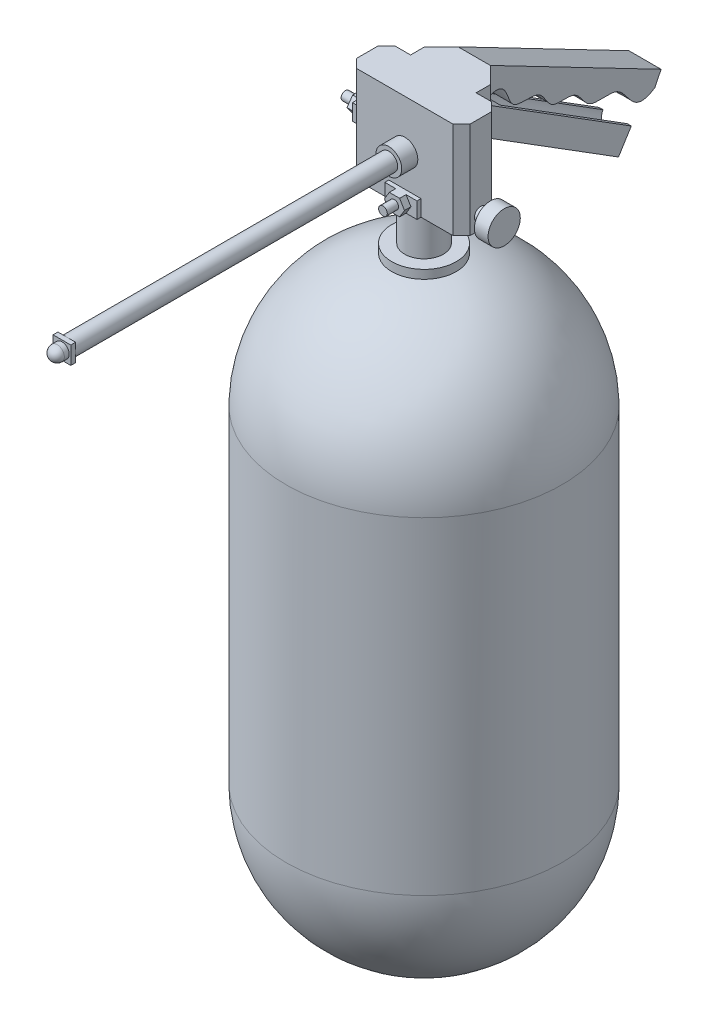
from build123d import *

# Parameters (mm, degrees)
SKETCH1_R                = 85.725
BOSS_EXTRUDE1_DEPTH      = 203.2
BOSS_EXTRUDE2_DEPTH      = 3
BOSS_EXTRUDE2_DEPTH_BACK = 3
SKETCH31_R               = 20
SKETCH32_R               = 12
BOSS_EXTRUDE3_DEPTH      = 25
BOSS_EXTRUDE6_DEPTH      = 60
SKETCH34_R               = 4
BOSS_EXTRUDE7_DEPTH      = 6
SKETCH35_R               = 10
BOSS_EXTRUDE8_DEPTH      = 8.5
SKETCH36_W               = 20
SKETCH36_H               = 10
BOSS_EXTRUDE9_DEPTH      = 2.5
BOSS_EXTRUDE10_DEPTH     = 4
SKETCH38_R               = 2.7
BOSS_EXTRUDE11_DEPTH     = 7
SKETCH39_W               = 13.421237438
SKETCH39_H               = 10
BOSS_EXTRUDE12_DEPTH     = 2.5
BOSS_EXTRUDE13_DEPTH     = 4
SKETCH41_R               = 2.7
BOSS_EXTRUDE14_DEPTH     = 7
SKETCH42_R               = 8
BOSS_EXTRUDE15_DEPTH     = 10
SKETCH43_R               = 5.5
BOSS_EXTRUDE16_DEPTH     = 200
SKETCH44_W               = 11
SKETCH44_H               = 11
BOSS_EXTRUDE17_DEPTH     = 3
SKETCH45_R               = 4.5
BOSS_EXTRUDE18_DEPTH     = 3
REVOLVE3_ANGLE           = 180
BOSS_EXTRUDE19_DEPTH     = 16
BOSS_EXTRUDE20_DEPTH     = 20
BOSS_EXTRUDE21_DEPTH     = 20
CUT_EXTRUDE2_DEPTH       = 93


with BuildPart() as part:
    # Sketch1 → Boss-Extrude1 (new body)
    with BuildSketch(Plane(origin=(0, 0, 0), x_dir=(1, 0, 0), z_dir=(0, 1, 0))):
        Circle(SKETCH1_R)
    extrude(amount=BOSS_EXTRUDE1_DEPTH)

    # Sketch28 → Revolve1 (revolve)
    with BuildSketch(Plane.XY):
        with BuildLine():
            Line((0, 287.318360821), (0, 201.578017622))
            Line((0, 201.578017622), (-85.725, 203.2))
            ThreePointArc((-85.725, 203.2), (-60.051382691, 262.776366365), (0, 287.318360821))
        make_face()
    revolve(axis=Axis((0, 313.857447871, 0), (0, -1, 0)))

    # Sketch29 → Revolve2 (revolve)
    with BuildSketch(Plane.XY):
        with BuildLine():
            Line((0, 0), (0, -85.725))
            ThreePointArc((0, -85.725), (60.616728817, -60.616728817), (85.725, 0))
            Line((85.725, 0), (0, 0))
        make_face()
    revolve(axis=Axis((0, 313.857447871, 0), (0, -1, 0)))

    # Sketch31 → Boss-Extrude2 (add, two sides: drawn at the far end of the back side and taken through both)
    with BuildSketch(Plane(origin=(0, 287.318360821, 0), x_dir=(1, 0, 0), z_dir=(0, 1, 0)).offset(-BOSS_EXTRUDE2_DEPTH_BACK)):
        Circle(SKETCH31_R)
    extrude(amount=BOSS_EXTRUDE2_DEPTH + BOSS_EXTRUDE2_DEPTH_BACK)

    # Sketch32 → Boss-Extrude3 (add)
    with BuildSketch(Plane(origin=(0, 290.318360821, 0), x_dir=(1, 0, 0), z_dir=(0, 1, 0))):
        Circle(SKETCH32_R)
    extrude(amount=BOSS_EXTRUDE3_DEPTH)

    # Sketch33 → Boss-Extrude6 (add)
    with BuildSketch(Plane(origin=(0, 315.318360821, 0), x_dir=(1, 0, 0), z_dir=(0, 1, 0))):
        Polygon((30, 12), (-30, 12), (-35.289381281, 6.710618719), (-35.289381281, -6.710618719), (-30, -12), (30, -12), (35.289381281, -6.710618719), (35.289381281, 6.710618719), align=None)
    extrude(amount=BOSS_EXTRUDE6_DEPTH)

    # Sketch34 → Boss-Extrude7 (add)
    with BuildSketch(Plane(origin=(35.289381281, 0, 0), x_dir=(0, 0, -1), z_dir=(1, 0, 0))):
        with Locations((0, 323.725459458)):
            Circle(SKETCH34_R)
    extrude(amount=BOSS_EXTRUDE7_DEPTH)

    # Sketch35 → Boss-Extrude8 (add)
    with BuildSketch(Plane(origin=(41.289381281, 0, 0), x_dir=(0, 0, -1), z_dir=(1, 0, 0))):
        with Locations((0, 323.725459458)):
            Circle(SKETCH35_R)
    extrude(amount=BOSS_EXTRUDE8_DEPTH)

    # Sketch36 → Boss-Extrude9 (add)
    with BuildSketch(Plane.XY.offset(12)):
        with Locations((0.143972637, 320.318360821)):
            Rectangle(SKETCH36_W, SKETCH36_H)
    extrude(amount=BOSS_EXTRUDE9_DEPTH)

    # Sketch37 → Boss-Extrude10 (add)
    with BuildSketch(Plane.XY.offset(14.5)):
        Polygon((0.143972637, 325.318360821), (3.343972637, 325.318360821), (6.386363787, 320.318362512), (3.343972637, 315.318360821), (-3.056027363, 315.318360821), (-6.098417484, 320.318360821), (-3.056027363, 325.318360821), align=None)
    extrude(amount=BOSS_EXTRUDE10_DEPTH)

    # Sketch38 → Boss-Extrude11 (add)
    with BuildSketch(Plane.XY.offset(18.5)):
        with Locations((0, 320.318362512)):
            Circle(SKETCH38_R)
    extrude(amount=BOSS_EXTRUDE11_DEPTH)

    # Sketch39 → Boss-Extrude12 (add)
    with BuildSketch(Plane.ZY.offset(35.289381281)):
        with Locations((0, 345.318360821)):
            Rectangle(SKETCH39_W, SKETCH39_H)
    extrude(amount=BOSS_EXTRUDE12_DEPTH)

    # Sketch40 → Boss-Extrude13 (add)
    with BuildSketch(Plane.ZY.offset(37.789381281)):
        Polygon((2.5, 350.318360821), (6.03894233, 345.318360821), (2.5, 340.318360821), (-2.5, 340.318360821), (-6.03894233, 345.318360821), (-2.5, 350.318360821), align=None)
    extrude(amount=BOSS_EXTRUDE13_DEPTH)

    # Sketch41 → Boss-Extrude14 (add)
    with BuildSketch(Plane.ZY.offset(41.789381281)):
        with Locations((0, 345.318360821)):
            Circle(SKETCH41_R)
    extrude(amount=BOSS_EXTRUDE14_DEPTH)

    # Sketch42 → Boss-Extrude15 (add)
    with BuildSketch(Plane.XY.offset(12)):
        with Locations((0.143972637, 345.318360821)):
            Circle(SKETCH42_R)
    extrude(amount=BOSS_EXTRUDE15_DEPTH)

    # Sketch43 → Boss-Extrude16 (add)
    with BuildSketch(Plane.XY.offset(22)):
        with Locations((0.143972637, 345.318360821)):
            Circle(SKETCH43_R)
    extrude(amount=BOSS_EXTRUDE16_DEPTH)

    # Sketch44 → Boss-Extrude17 (add)
    with BuildSketch(Plane.XY.offset(222)):
        with Locations((0.143972637, 345.318360821)):
            Rectangle(SKETCH44_W, SKETCH44_H)
    extrude(amount=BOSS_EXTRUDE17_DEPTH)

    # Sketch45 → Boss-Extrude18 (add)
    with BuildSketch(Plane.XY.offset(225)):
        with Locations((0.143972637, 345.318360821)):
            Circle(SKETCH45_R)
    extrude(amount=BOSS_EXTRUDE18_DEPTH)

    # Sketch47 → Revolve3 (revolve)
    with BuildSketch(Plane.XY.offset(228)):
        with BuildLine():
            ThreePointArc((4.643972637, 345.318360821), (3.325953153, 348.500341336), (0.143972637, 349.818360821))
            Line((0.143972637, 349.818360821), (0.143972637, 340.818360821))
            ThreePointArc((0.143972637, 340.818360821), (3.325953153, 342.136380306), (4.643972637, 345.318360821))
        make_face()
    revolve(axis=Axis((0.143972637, 349.818360821, 228), (0, -1, 0)), revolution_arc=REVOLVE3_ANGLE)

    # Sketch48 → Boss-Extrude19 (add)
    with BuildSketch(Plane(origin=(0, 375.318360821, 0), x_dir=(1, 0, 0), z_dir=(0, 1, 0))):
        Polygon((-20.357899108, -12), (-20.357899108, 20.820157016), (-10.038977344, 31.139078781), (10.038977344, 31.139078781), (20.357899108, 20.820157016), (20.357899108, -12), align=None)
    extrude(amount=-BOSS_EXTRUDE19_DEPTH)

    # Sketch52 → Boss-Extrude20 (add)
    with BuildSketch(Plane.ZY.offset(-10.038977344)):
        with BuildLine():
            Line((-31.139078781, 375.318360821), (-137.198476882, 320.216318652))
            Line((-137.198476882, 320.216318652), (-133.330265792, 312.290268057))
            add(Edge.make_bspline(
                [(-31.139078781, 359.318360821), (-42.379778295, 363.158353756), (-39.591693022, 340.818653922), (-62.888798291, 349.099143654), (-67.926909039, 331.053173549), (-84.980722767, 337.146273437), (-91.529623803, 319.105472959), (-116.352369344, 328.68437575), (-119.116532875, 302.808333213), (-133.330265792, 312.290268057)],
                knots=[0, 0, 0, 0, 0.166177643, 0.304820008, 0.403836768, 0.523806209, 0.62872413, 0.776596545, 1, 1, 1, 1], degree=3))
            Line((-31.139078781, 359.318360821), (-31.139078781, 375.318360821))
        make_face()
    extrude(amount=BOSS_EXTRUDE20_DEPTH)

    # Sketch53 → Boss-Extrude21 (add)
    with BuildSketch(Plane.ZY.offset(-10.038977344)):
        Polygon((-25.979617899, 359.318360821), (-25.979617899, 339.318360821), (-110.737722603, 286.251764106), (-118.69771211, 298.965479812), (-31.139078781, 353.785472543), (-31.139078781, 359.318360821), align=None)
    extrude(amount=BOSS_EXTRUDE21_DEPTH)

    # Sketch55 → Cut-Extrude2 (cut)
    with BuildSketch(Plane(origin=(0, 30.802439398, 49.197735399), x_dir=(-1, 0, 0), z_dir=(1.7575320948605254e-15, -0.5306659671461025, -0.8475810470467657))):
        with BuildLine():
            Line((7.49999746, 316.386310605), (-7.49999746, 316.386310605))
            ThreePointArc((-7.49999746, 316.386310605), (0, 308.886313145), (7.49999746, 316.386310605))
        make_face()
    extrude(amount=-CUT_EXTRUDE2_DEPTH, mode=Mode.SUBTRACT)


solid = part.part
